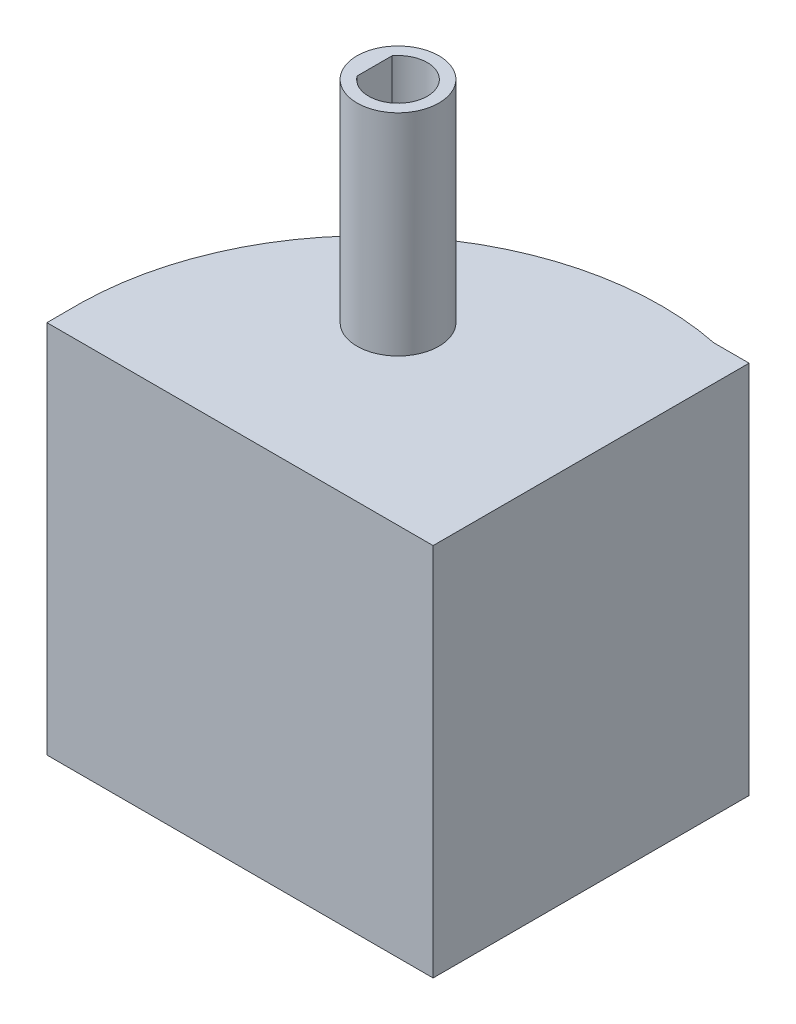
from build123d import *

# Parameters (mm, degrees)
SKETCH1_W           = 30
SKETCH1_H           = 3
EXTRUDE_THIN1_DEPTH = 24
SKETCH2_W           = 7.5
SKETCH2_H           = 7.5
CUT_EXTRUDE1_DEPTH  = 39.535697736
FILLET1_R           = 1
BOSS_EXTRUDE1_DEPTH = 32
BOSS_EXTRUDE2_DEPTH = 3
SKETCH7_R           = 3.5
BOSS_EXTRUDE3_DEPTH = 18


with BuildPart() as part:
    # Sketch1 → Extrude-Thin1 (new body)
    with BuildSketch(Plane.XY):
        with Locations((15, 1.5)):
            Rectangle(SKETCH1_W, SKETCH1_H)
    extrude(amount=-EXTRUDE_THIN1_DEPTH)

    # Sketch2 → Cut-Extrude1 (cut, through all)
    with BuildSketch(Plane(origin=(0, 3, 0), x_dir=(1, 0, 0), z_dir=(0, 1, 0))):
        with BuildLine():
            Line((18, 18.5), (18, 24))
            Line((18, 24), (0, 24))
            Line((0, 24), (0, 5.5))
            Line((0, 5.5), (5.5, 5.5))
            ThreePointArc((5.5, 5.5), (9.131961826, 14.517344398), (18, 18.5))
        make_face()
        with Locations((15, 12)):
            Rectangle(SKETCH2_W, SKETCH2_H)
    extrude(amount=-CUT_EXTRUDE1_DEPTH, mode=Mode.SUBTRACT)

    # Fillet1
    fillet1_edges = [part.edges().sort_by_distance(p)[0] for p in [
        (18.75, 1.5, -8.25),
        (11.25, 1.5, -8.25),
        (11.25, 1.5, -15.75),
        (18.75, 1.5, -15.75),
    ]]
    fillet(fillet1_edges, radius=FILLET1_R)

    # Sketch4 → Boss-Extrude1 (add)
    with BuildSketch(Plane.XZ):
        Polygon((0, 0), (0, 3), (33, 3), (33, -24), (30, -24), (30, 0), align=None)
    extrude(amount=-BOSS_EXTRUDE1_DEPTH)

    # Sketch6 → Boss-Extrude2 (add)
    with BuildSketch(Plane(origin=(0, 32, 0), x_dir=(1, 0, 0), z_dir=(0, 1, 0))):
        with BuildLine():
            Line((0, 0), (30, 0))
            Line((30, 0), (30, 24))
            ThreePointArc((30, 24), (9.377744572, 19.027819285), (0, 0))
        make_face()
    extrude(amount=-BOSS_EXTRUDE2_DEPTH)

    # Sketch7 → Boss-Extrude3 (add)
    with BuildSketch(Plane(origin=(0, 32, 0), x_dir=(1, 0, 0), z_dir=(0, 1, 0))):
        with Locations((15, 12)):
            Circle(SKETCH7_R)
        with BuildLine():
            Line((13, 13.5), (13, 10.5))
            ThreePointArc((13, 10.5), (17.5, 12), (13, 13.5))
        make_face(mode=Mode.SUBTRACT)
    extrude(amount=BOSS_EXTRUDE3_DEPTH)


solid = part.part
